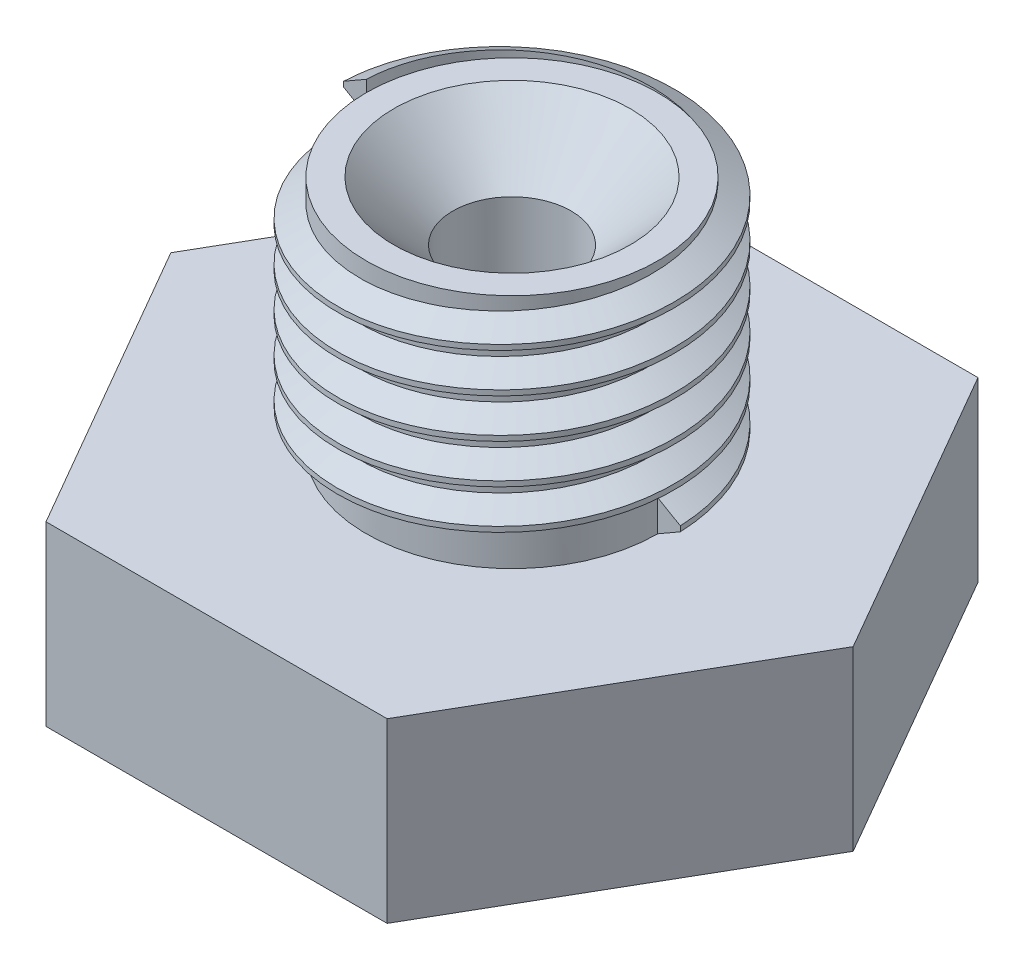
from build123d import *

# Parameters (mm, degrees)
ESQUISSE2_R             = 9
ENL_V_MAT_EXTRU_1_DEPTH = 16.033296378
FILETAGE2_PITCH         = 1


with BuildPart() as part:
    # Esquisse1 → Révolution1 (revolve)
    with BuildSketch(Plane.XY, mode=Mode.PRIVATE) as r_volution1_sk:
        Polygon((0.5, 0), (0.5, 1.5), (1.5, 2.5), (1.5, 12.5), (3, 14), (3.7, 14), (3.7, 8), (9, 8), (9, 3.5), (4, 3.5), align=None)
    revolve(r_volution1_sk.sketch.rotate(Axis((0, 0, 0), (0, 1, 0)), 90), axis=Axis((0, 0, 0), (0, 1, 0)))

    # Esquisse2 → Enlèv. mat.-Extru.1 (cut, through all)
    with BuildSketch(Plane(origin=(0, 8, 0), x_dir=(1, 0, 0), z_dir=(0, 1, 0))):
        Circle(ESQUISSE2_R)
        Polygon((-8.660254038, 0), (-4.330127019, 7.5), (4.330127019, 7.5), (8.660254038, 0), (4.330127019, -7.5), (-4.330127019, -7.5), align=None, mode=Mode.SUBTRACT)
    extrude(amount=-ENL_V_MAT_EXTRU_1_DEPTH, mode=Mode.SUBTRACT)

    # Filetage2: the profile of Profil de filetage2 profile screwed along a right-hand helix of 5.5 turns, 8 arcs to a turn; built about Z, then put on its axis
    filetage2_z = Axis((0, 0, 0), (0, 0, 1))
    filetage2_corners = [(3.6997, 0, -0.000173205), (4.272839718, 0, 0.330729165), (4.272839718, 0, 0.463020832), (3.6997, 0, 0.793923202)]
    with BuildLine(mode=Mode.PRIVATE) as filetage2_profile:
        Line(filetage2_corners[0], filetage2_corners[1])
        Line(filetage2_corners[1], filetage2_corners[2])
        Line(filetage2_corners[2], filetage2_corners[3])
        Line(filetage2_corners[3], filetage2_corners[0])
    filetage2_cap = Face(filetage2_profile.wire())
    filetage2_turn_angles = [0, 22.5, 45, 67.5, 90, 112.5, 135, 157.5, 180, 202.5, 225, 247.5, 270, 292.5, 315, 337.5, 360]
    filetage2_turn_weights = [1, 0.9238795325112867, 1, 0.9238795325112867, 1, 0.9238795325112867, 1, 0.9238795325112867, 1, 0.9238795325112867, 1, 0.9238795325112867, 1, 0.9238795325112867, 1, 0.9238795325112867, 1]
    filetage2_turn_rails = [Edge.make_bspline([Vector(p[0], p[1], 0).rotate(filetage2_z, filetage2_turn_angles[k]) / filetage2_turn_weights[k] + Vector(0, 0, p[2] + FILETAGE2_PITCH * filetage2_turn_angles[k] / 360) for k in range(17)], [0, 0, 0, 1, 1, 2, 2, 3, 3, 4, 4, 5, 5, 6, 6, 7, 7, 8, 8, 8], 2, filetage2_turn_weights) for p in filetage2_corners]
    filetage2_turn_sides = [Face.make_surface_from_curves(filetage2_turn_rails[p[0]], filetage2_turn_rails[p[1]]) for p in [(0, 1), (1, 2), (2, 3), (3, 0)]]
    filetage2_last_angles = [1800, 1822.5, 1845, 1867.5, 1890, 1912.5, 1935, 1957.5, 1980]
    filetage2_last_weights = [1, 0.9238795325112867, 1, 0.9238795325112867, 1, 0.9238795325112867, 1, 0.9238795325112867, 1]
    filetage2_last_rails = [Edge.make_bspline([Vector(p[0], p[1], 0).rotate(filetage2_z, filetage2_last_angles[k]) / filetage2_last_weights[k] + Vector(0, 0, p[2] + FILETAGE2_PITCH * filetage2_last_angles[k] / 360) for k in range(9)], [0, 0, 0, 1, 1, 2, 2, 3, 3, 4, 4, 4], 2, filetage2_last_weights) for p in filetage2_corners]
    filetage2_last_sides = [Face.make_surface_from_curves(filetage2_last_rails[p[0]], filetage2_last_rails[p[1]]) for p in [(0, 1), (1, 2), (2, 3), (3, 0)]]
    filetage2 = Plane(origin=(0, 8, 0), x_dir=(1, 0, 0), z_dir=(0, 1, 0)) * Solid(Shell([*[p.moved(Location((0, 0, FILETAGE2_PITCH * i))) for i in range(5) for p in filetage2_turn_sides], *filetage2_last_sides, filetage2_cap, filetage2_cap.rotate(filetage2_z, 1980).moved(Location((0, 0, FILETAGE2_PITCH * 1980 / 360)))]))
    add(filetage2)


solid = part.part
